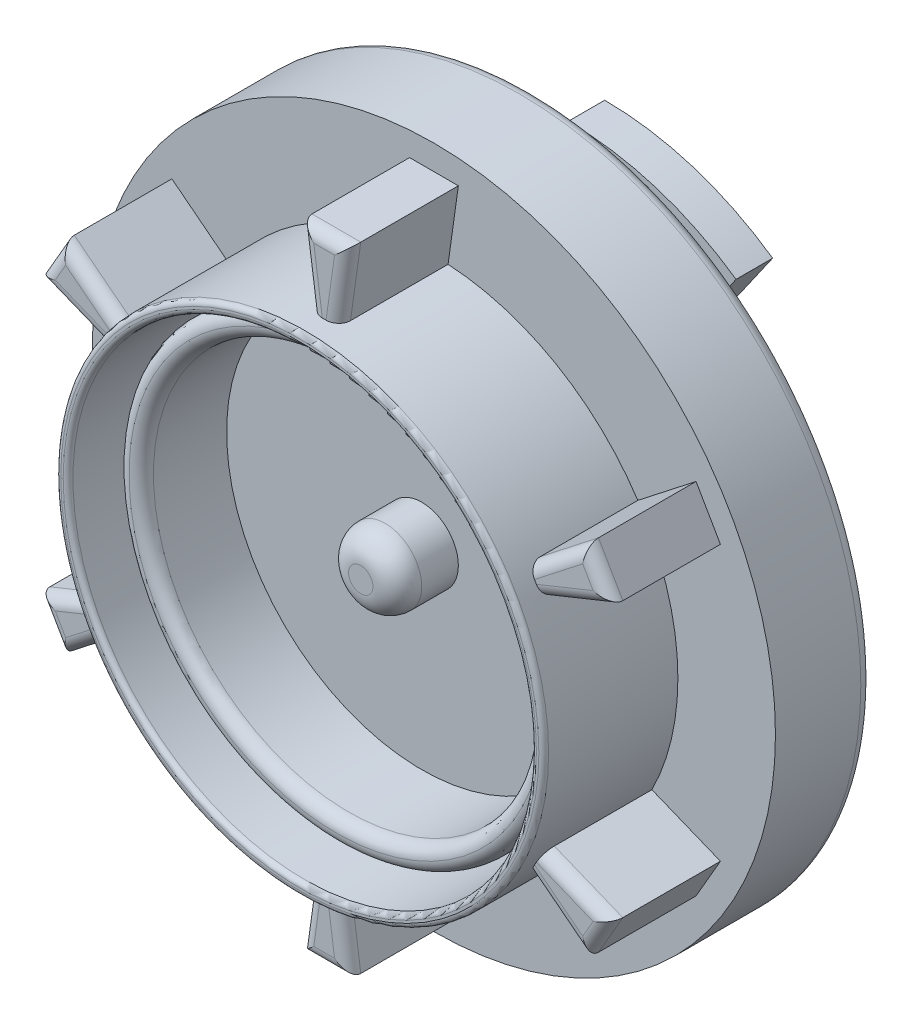
from build123d import *

# Parameters (mm, degrees)
SKETCH1_R           = 25.4
BOSS_EXTRUDE1_DEPTH = 13.97
SKETCH3_R           = 35.56
BOSS_EXTRUDE2_DEPTH = 10.16
SKETCH4_R           = 17.78
CUT_EXTRUDE2_DEPTH  = 10.16
CUT_EXTRUDE3_DEPTH  = 7.62
CUT_EXTRUDE4_DEPTH  = 5.08
BOSS_EXTRUDE3_START = 3.81
BOSS_EXTRUDE3_DEPTH = 3.81
BOSS_EXTRUDE4_START = 3.81
BOSS_EXTRUDE4_DEPTH = 3.81
FILLET1_R           = 1.27
BOSS_EXTRUDE5_START = 3.81
BOSS_EXTRUDE5_DEPTH = 3.81
BOSS_EXTRUDE6_START = 3.81
BOSS_EXTRUDE6_DEPTH = 3.81
SKETCH12_R          = 19.685
SKETCH12_R_2        = 15.494
CUT_EXTRUDE5_DEPTH  = 5.08
CUT_EXTRUDE6_DEPTH  = 7.62
CUT_EXTRUDE7_DEPTH  = 5.08
CUT_EXTRUDE9_START  = -13.97
SKETCH17_R          = 24.13
SKETCH17_R_2        = 22.86
CUT_EXTRUDE9_DEPTH  = 13.97
SKETCH18_R          = 20.32
SKETCH18_R_2        = 19.05
CUT_EXTRUDE10_DEPTH = 12.7
SKETCH19_R          = 19.05
SKETCH19_R_2        = 3.81
CUT_EXTRUDE11_DEPTH = 12.7
SKETCH20_R          = 3.81
CUT_EXTRUDE12_DEPTH = 6.35
FILLET3_R           = 2.54
FILLET5_R           = 0.508
SKETCH21_R          = 22.86
SKETCH21_R_2        = 20.32
CUT_EXTRUDE13_DEPTH = 3.81
FILLET6_R           = 1.27
BOSS_EXTRUDE8_DEPTH = 11.43
FILLET7_R           = 1.27


with BuildPart() as part:
    # Sketch1 → Boss-Extrude1 (new body)
    with BuildSketch(Plane.XY):
        Circle(SKETCH1_R)
    extrude(amount=BOSS_EXTRUDE1_DEPTH)

    # Sketch3 → Boss-Extrude2 (add)
    with BuildSketch(Plane(origin=(0, 0, 0), x_dir=(-1, 0, 0), z_dir=(0, 0, -1))):
        Circle(SKETCH3_R)
    extrude(amount=BOSS_EXTRUDE2_DEPTH)

    # Sketch4 → Cut-Extrude2 (cut)
    with BuildSketch(Plane(origin=(0, 0, -10.16), x_dir=(-1, 0, 0), z_dir=(0, 0, -1))):
        Circle(SKETCH4_R)
    extrude(amount=-CUT_EXTRUDE2_DEPTH, mode=Mode.SUBTRACT)

    # Sketch5 → Cut-Extrude3 (cut)
    with BuildSketch(Plane(origin=(0, 0, -10.16), x_dir=(-1, 0, 0), z_dir=(0, 0, -1))):
        with BuildLine():
            Line((0, 24.13), (0, 33.02))
            ThreePointArc((0, 33.02), (10.414, 31.334789037), (19.765020777, 26.451169231))
            ThreePointArc((19.765020777, 26.451169231), (21.045077133, 24.982065605), (21.60614426, 23.11605022))
            ThreePointArc((21.60614426, 23.11605022), (21.993466722, 21.536683666), (22.86, 20.16062499))
            ThreePointArc((22.86, 20.16062499), (30.158193368, -4.417439617), (16.117651007, -25.8699))
            Line((16.117651007, -25.8699), (12.759807047, -20.4803375))
            ThreePointArc((12.759807047, -20.4803375), (23.199649177, 6.63575), (0, 24.13))
        make_face()
    extrude(amount=-CUT_EXTRUDE3_DEPTH, mode=Mode.SUBTRACT)

    # Sketch7 → Cut-Extrude4 (cut)
    with BuildSketch(Plane(origin=(0, 0, -7.62), x_dir=(-1, 0, 0), z_dir=(0, 0, -1))):
        with BuildLine():
            Line((17.460788591, -28.025725), (16.117651007, -25.8699))
            ThreePointArc((16.117651007, -25.8699), (30.158193368, -4.417439617), (22.86, 20.16062499))
            ThreePointArc((22.86, 20.16062499), (21.993466722, 21.536683666), (21.60614426, 23.11605022))
            ThreePointArc((21.60614426, 23.11605022), (21.045077133, 24.982065605), (19.765020777, 26.451169231))
            ThreePointArc((19.765020777, 26.451169231), (32.990501997, -1.395413186), (17.460788591, -28.025725))
        make_face()
    extrude(amount=-CUT_EXTRUDE4_DEPTH, mode=Mode.SUBTRACT)

    # Sketch8 → Boss-Extrude3 (add)
    with BuildSketch(Plane(origin=(0, 0, -10.16), x_dir=(-1, 0, 0), z_dir=(0, 0, -1)).offset(BOSS_EXTRUDE3_START)):
        with BuildLine():
            Line((0, -27.94), (0, -24.13))
            ThreePointArc((0, -24.13), (6.63575, -23.199649177), (12.759807047, -20.4803375))
            Line((12.759807047, -20.4803375), (14.774513423, -23.714075))
            ThreePointArc((14.774513423, -23.714075), (7.6835, -26.862751679), (0, -27.94))
        make_face()
    extrude(amount=-BOSS_EXTRUDE3_DEPTH)

    # Sketch9 → Boss-Extrude4 (add)
    with BuildSketch(Plane(origin=(0, 0, -13.97), x_dir=(-1, 0, 0), z_dir=(0, 0, -1)).offset(BOSS_EXTRUDE4_START)):
        with BuildLine():
            Line((0, -24.13), (0, -30.48))
            ThreePointArc((0, -30.48), (8.382, -29.304820013), (16.117651007, -25.8699))
            Line((16.117651007, -25.8699), (12.759807047, -20.4803375))
            ThreePointArc((12.759807047, -20.4803375), (6.63575, -23.199649177), (0, -24.13))
        make_face()
    extrude(amount=-BOSS_EXTRUDE4_DEPTH)

    # Fillet1
    fillet1_edges = [part.edges().sort_by_distance(p)[0] for p in [
        (35.56, 0, -10.16),
    ]]
    fillet(fillet1_edges, radius=FILLET1_R)

    # Sketch10 → Boss-Extrude5 (add)
    with BuildSketch(Plane(origin=(0, 0, -10.16), x_dir=(-1, 0, 0), z_dir=(0, 0, -1)).offset(BOSS_EXTRUDE5_START)):
        with BuildLine():
            Line((-13.819909091, 19.780470488), (-16.002, 22.90370267))
            ThreePointArc((-16.002, 22.90370267), (-8.387912356, 26.651201217), (0, 27.94))
            Line((0, 27.94), (0, 24.13))
            ThreePointArc((0, 24.13), (-7.244106126, 23.016946505), (-13.819909091, 19.780470488))
        make_face()
    extrude(amount=-BOSS_EXTRUDE5_DEPTH)

    # Sketch11 → Boss-Extrude6 (add)
    with BuildSketch(Plane(origin=(0, 0, -13.97), x_dir=(-1, 0, 0), z_dir=(0, 0, -1)).offset(BOSS_EXTRUDE6_START)):
        with BuildLine():
            Line((-13.819909091, 19.780470488), (-17.486542269, 25.028531737))
            ThreePointArc((-17.486542269, 25.028531737), (-9.166078238, 29.123694325), (0, 30.53205793))
            Line((0, 30.53205793), (0, 24.13))
            ThreePointArc((0, 24.13), (-7.244106126, 23.016946505), (-13.819909091, 19.780470488))
        make_face()
    extrude(amount=-BOSS_EXTRUDE6_DEPTH)

    # Sketch12 → Cut-Extrude5 (cut)
    with BuildSketch(Plane(origin=(0, 0, -10.16), x_dir=(-1, 0, 0), z_dir=(0, 0, -1))):
        Circle(SKETCH12_R)
        Circle(SKETCH12_R_2, mode=Mode.SUBTRACT)
    extrude(amount=-CUT_EXTRUDE5_DEPTH, mode=Mode.SUBTRACT)

    # Sketch13 → Cut-Extrude6 (cut)
    with BuildSketch(Plane(origin=(0, 0, -10.16), x_dir=(-1, 0, 0), z_dir=(0, 0, -1))):
        with BuildLine():
            Line((-16.002, 22.90370267), (-13.819909091, 19.780470488))
            ThreePointArc((-13.819909091, 19.780470488), (-23.016946505, -7.244106126), (0, -24.13))
            Line((0, -24.13), (0, -30.48))
            ThreePointArc((0, -30.48), (-10.414, -28.645750191), (-19.574595964, -23.363766667))
            ThreePointArc((-19.574595964, -23.363766667), (-20.902767484, -21.720232391), (-21.5114344, -19.696678812))
            ThreePointArc((-21.5114344, -19.696678812), (-21.950994255, -17.793379172), (-22.86, -16.064370514))
            ThreePointArc((-22.86, -16.064370514), (-27.51711182, 4.842742724), (-16.002, 22.90370267))
        make_face()
    extrude(amount=-CUT_EXTRUDE6_DEPTH, mode=Mode.SUBTRACT)

    # Sketch15 → Cut-Extrude7 (cut)
    with BuildSketch(Plane(origin=(0, 0, -7.62), x_dir=(-1, 0, 0), z_dir=(0, 0, -1))):
        with BuildLine():
            Line((-17.456727273, 24.985857458), (-16.002, 22.90370267))
            ThreePointArc((-16.002, 22.90370267), (-27.51711182, 4.842742724), (-22.86, -16.064370514))
            ThreePointArc((-22.86, -16.064370514), (-21.950994255, -17.793379172), (-21.5114344, -19.696678812))
            ThreePointArc((-21.5114344, -19.696678812), (-20.902767484, -21.720232391), (-19.574595964, -23.363766667))
            ThreePointArc((-19.574595964, -23.363766667), (-30.450800702, 1.333842788), (-17.456727273, 24.985857458))
        make_face()
    extrude(amount=-CUT_EXTRUDE7_DEPTH, mode=Mode.SUBTRACT)

    # Sketch17 → Cut-Extrude9 (cut)
    with BuildSketch(Plane.XY.offset(13.97).offset(CUT_EXTRUDE9_START)):
        Circle(SKETCH17_R)
        Circle(SKETCH17_R_2, mode=Mode.SUBTRACT)
    extrude(amount=CUT_EXTRUDE9_DEPTH, mode=Mode.SUBTRACT)

    # Sketch18 → Cut-Extrude10 (cut)
    with BuildSketch(Plane.XY.offset(13.97)):
        Circle(SKETCH18_R)
        Circle(SKETCH18_R_2, mode=Mode.SUBTRACT)
    extrude(amount=-CUT_EXTRUDE10_DEPTH, mode=Mode.SUBTRACT)

    # Sketch19 → Cut-Extrude11 (cut)
    with BuildSketch(Plane.XY.offset(13.97)):
        Circle(SKETCH19_R)
        Circle(SKETCH19_R_2, mode=Mode.SUBTRACT)
    extrude(amount=-CUT_EXTRUDE11_DEPTH, mode=Mode.SUBTRACT)

    # Sketch20 → Cut-Extrude12 (cut)
    with BuildSketch(Plane.XY.offset(13.97)):
        Circle(SKETCH20_R)
    extrude(amount=-CUT_EXTRUDE12_DEPTH, mode=Mode.SUBTRACT)

    # Fillet3
    fillet3_edges = [part.edges().sort_by_distance(p)[0] for p in [
        (-3.81, 0, 7.62),
    ]]
    fillet(fillet3_edges, radius=FILLET3_R)

    # Fillet5
    fillet5_edges = [part.edges().sort_by_distance(p)[0] for p in [
        (-24.13, 0, 13.97),
        (-25.4, 0, 13.97),
    ]]
    fillet(fillet5_edges, radius=FILLET5_R)

    # Sketch21 → Cut-Extrude13 (cut)
    with BuildSketch(Plane.XY.offset(13.97)):
        Circle(SKETCH21_R)
        Circle(SKETCH21_R_2, mode=Mode.SUBTRACT)
    extrude(amount=-CUT_EXTRUDE13_DEPTH, mode=Mode.SUBTRACT)

    # Fillet6
    fillet6_edges = [part.edges().sort_by_distance(p)[0] for p in [
        (-22.86, 0, 10.16),
        (-20.32, 0, 10.16),
    ]]
    fillet(fillet6_edges, radius=FILLET6_R - 0.0001)  # a hair under: the kernel refuses the full size

    # Sketch22 → Boss-Extrude8 (add)
    with BuildSketch(Plane.XY):
        with BuildLine():
            Line((-1.46907884, 25.357480304), (-2.54, 32.977480304))
            Line((-2.54, 32.977480304), (2.54, 32.977480304))
            Line((2.54, 32.977480304), (1.46907884, 25.357480304))
            ThreePointArc((1.46907884, 25.357480304), (0, 25.4), (-1.46907884, 25.357480304))
        make_face()
        with BuildLine():
            Line((21.225682699, 13.950999747), (27.289335696, 18.688444678))
            Line((27.289335696, 18.688444678), (29.829335696, 14.289035626))
            Line((29.829335696, 14.289035626), (22.694761539, 11.406480557))
            ThreePointArc((22.694761539, 11.406480557), (21.997045256, 12.7), (21.225682699, 13.950999747))
        make_face()
        with BuildLine():
            Line((22.694761539, -11.406480557), (29.829335696, -14.289035626))
            Line((29.829335696, -14.289035626), (27.289335696, -18.688444678))
            Line((27.289335696, -18.688444678), (21.225682699, -13.950999747))
            ThreePointArc((21.225682699, -13.950999747), (21.997045256, -12.7), (22.694761539, -11.406480557))
        make_face()
        with BuildLine():
            Line((1.46907884, -25.357480304), (2.54, -32.977480304))
            Line((2.54, -32.977480304), (-2.54, -32.977480304))
            Line((-2.54, -32.977480304), (-1.46907884, -25.357480304))
            ThreePointArc((-1.46907884, -25.357480304), (0, -25.4), (1.46907884, -25.357480304))
        make_face()
        with BuildLine():
            Line((-21.225682699, -13.950999747), (-27.289335696, -18.688444678))
            Line((-27.289335696, -18.688444678), (-29.829335696, -14.289035626))
            Line((-29.829335696, -14.289035626), (-22.694761539, -11.406480557))
            ThreePointArc((-22.694761539, -11.406480557), (-21.997045256, -12.7), (-21.225682699, -13.950999747))
        make_face()
        with BuildLine():
            Line((-22.694761539, 11.406480557), (-29.829335696, 14.289035626))
            Line((-29.829335696, 14.289035626), (-27.289335696, 18.688444678))
            Line((-27.289335696, 18.688444678), (-21.225682699, 13.950999747))
            ThreePointArc((-21.225682699, 13.950999747), (-21.997045256, 12.7), (-22.694761539, 11.406480557))
        make_face()
    extrude(amount=BOSS_EXTRUDE8_DEPTH)

    # Fillet7
    fillet7_edges = [part.edges().sort_by_distance(p)[0] for p in [
        (2.00453942, 29.167480304, 11.43),
        (0, 32.977480304, 11.43),
        (-2.00453942, 29.167480304, 11.43),
        (26.262048617, 12.847758092, 11.43),
        (28.559335696, 16.488740152, 11.43),
        (24.257509198, 16.319722212, 11.43),
        (24.257509198, -16.319722212, 11.43),
        (28.559335696, -16.488740152, 11.43),
        (26.262048617, -12.847758092, 11.43),
        (-2.00453942, -29.167480304, 11.43),
        (0, -32.977480304, 11.43),
        (2.00453942, -29.167480304, 11.43),
        (-26.262048617, -12.847758092, 11.43),
        (-28.559335696, -16.488740152, 11.43),
        (-24.257509198, -16.319722212, 11.43),
        (-24.257509198, 16.319722212, 11.43),
        (-28.559335696, 16.488740152, 11.43),
        (-26.262048617, 12.847758092, 11.43),
    ]]
    fillet(fillet7_edges, radius=FILLET7_R)


solid = part.part
